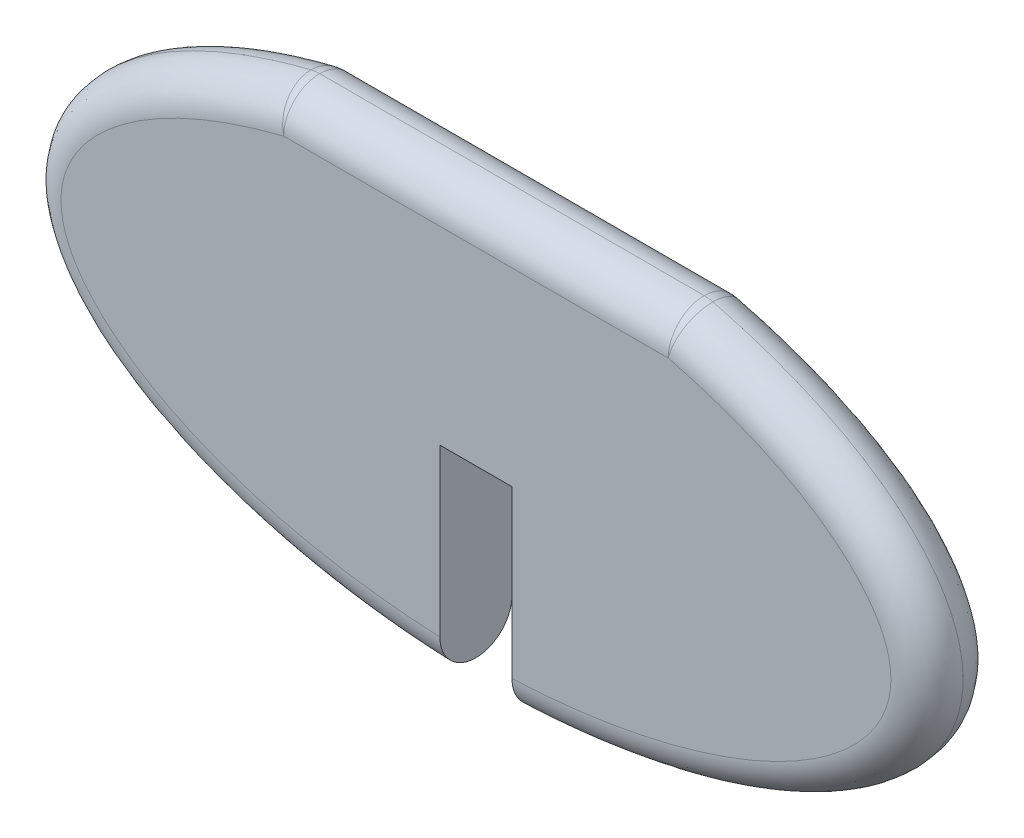
from build123d import *

# Parameters (mm, degrees)
EXTRUDE_1_DEPTH = 8
FILLET_1_R      = 4
FILLET_2_R      = 4


with BuildPart() as part:
    # 草圖1 → 填料-伸長1 (new body)
    with BuildSketch(Plane.XY):
        with BuildLine():
            Line((-21.794494718, 22.5), (21.794494718, 22.5))
            add(Edge.make_bspline(
                [(4.001018688, -24.919830705), (187.241279836, -17.564767604), (21.794494718, 22.5)],
                knots=[4.792495, 4.792495, 4.792495, 7.402954822, 7.402954822, 7.402954822], degree=2, weights=[1, 0.26245587, 1]))
            Line((4.001018688, -24.919830705), (4.001018688, -2.5))
            Line((4.001018688, -2.5), (-3.998981312, -2.5))
            Line((-3.998981312, -2.5), (-3.998981312, -24.919912462))
            add(Edge.make_bspline(
                [(-21.794494718, 22.5), (-187.254633424, -17.568001322), (-3.998981312, -24.919912462)],
                knots=[2.021823139, 2.021823139, 2.021823139, 4.63232384, 4.63232384, 4.63232384], degree=2, weights=[1, 0.262436147, 1]))
        make_face()
    extrude(amount=EXTRUDE_1_DEPTH)

    # 圓角1
    fillet_1_edges = [part.edges().sort_by_distance(p)[0] for p in [
        (21.794494718, 22.5, 4),
        (-21.794494718, 22.5, 4),
    ]]
    fillet(fillet_1_edges, radius=FILLET_1_R)

    # 圓角2
    fillet_2_edges = [part.edges().sort_by_distance(p)[0] for p in [
        (49.062674156, -4.818039142, 0),
        (21.797330621, 22.470299383, 0),
        (-49.062475922, -4.818543773, 0),
        (-21.797330621, 22.470299383, 0),
        (49.062674156, -4.818039142, 8),
        (21.797330621, 22.470299383, 8),
        (-49.062475922, -4.818543773, 8),
        (-21.797330621, 22.470299383, 8),
        (0, 22.5, 0),
        (0, 22.5, 8),
    ]]
    fillet(fillet_2_edges, radius=FILLET_2_R - 0.0001)  # a hair under: the kernel refuses the full size


solid = part.part
